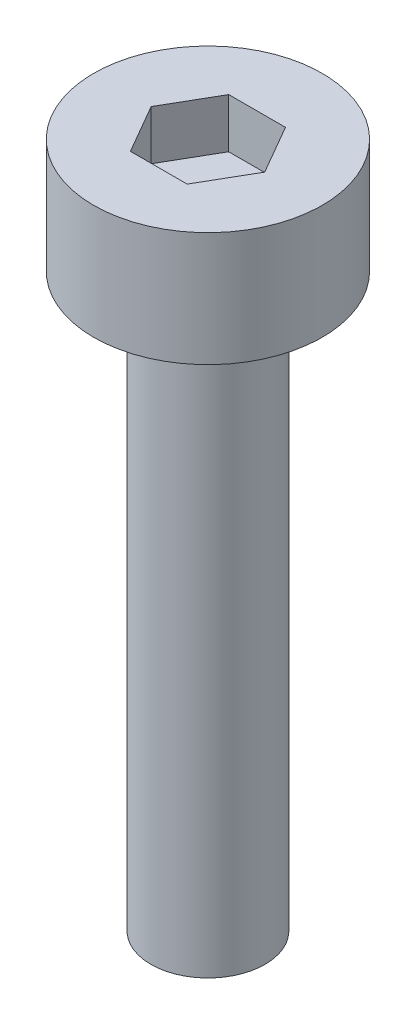
from build123d import *

# Parameters (mm, degrees)
SKETCH1_R           = 1.5
SCREWSHAFT_DEPTH    = 15
SKETCH2_R           = 3
BOSS_EXTRUDE2_DEPTH = 3
CUT_EXTRUDE1_DEPTH  = 1.3


with BuildPart() as part:
    # Sketch1 → ScrewShaft (new body)
    with BuildSketch(Plane(origin=(0, 0, 0), x_dir=(1, 0, 0), z_dir=(0, 1, 0))):
        Circle(SKETCH1_R)
    extrude(amount=SCREWSHAFT_DEPTH)

    # Sketch2 → Boss-Extrude2 (add)
    with BuildSketch(Plane(origin=(0, 15, 0), x_dir=(1, 0, 0), z_dir=(0, 1, 0))):
        Circle(SKETCH2_R)
    extrude(amount=BOSS_EXTRUDE2_DEPTH)

    # Sketch3 → Cut-Extrude1 (cut)
    with BuildSketch(Plane(origin=(0, 18, 0), x_dir=(1, 0, 0), z_dir=(0, 1, 0))):
        Polygon((1.489563695, 0), (0.744781847, 1.29), (-0.744781847, 1.29), (-1.489563695, 0), (-0.744781847, -1.29), (0.744781847, -1.29), align=None)
    extrude(amount=-CUT_EXTRUDE1_DEPTH, mode=Mode.SUBTRACT)


solid = part.part
